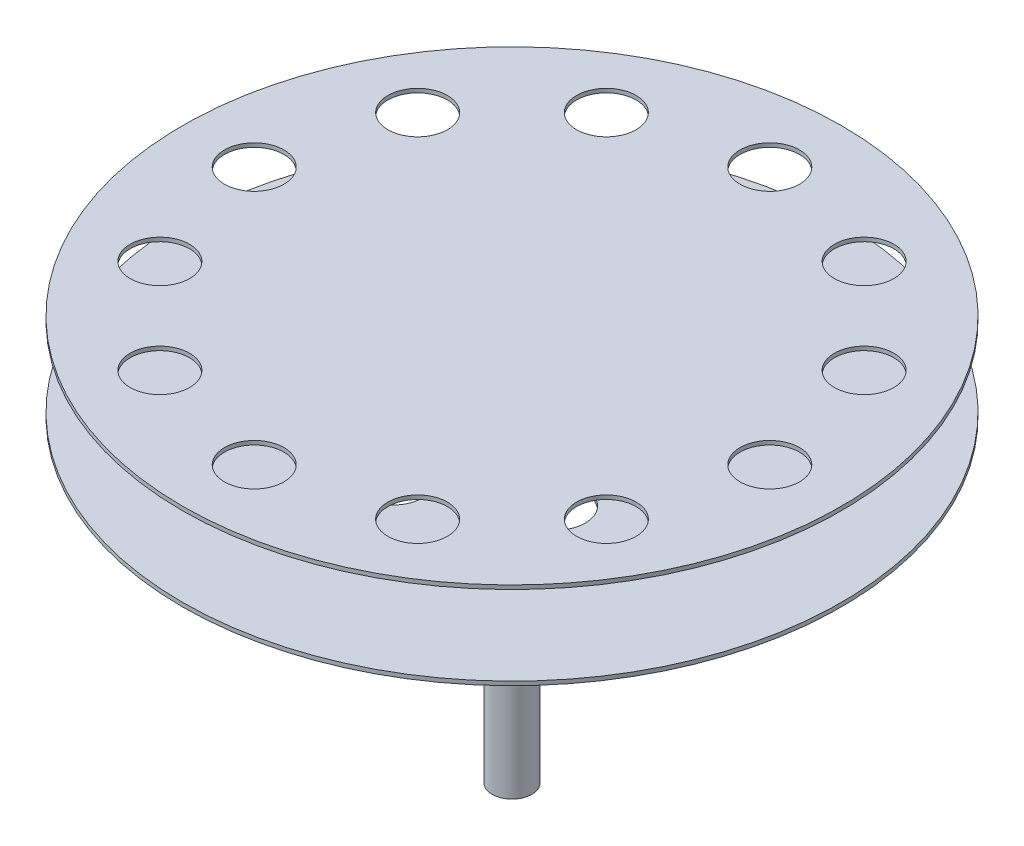
from build123d import *

# Parameters (mm, degrees)
SKETCH2_R          = 7.5
CUT_EXTRUDE1_DEPTH = 2
CIRPATTERN1_COUNT  = 12
SKETCH3_R          = 7.5
CUT_EXTRUDE2_DEPTH = 2
CIRPATTERN2_COUNT  = 6


with BuildPart() as part:
    # Sketch1 → Revolve1 (revolve)
    with BuildSketch(Plane.XY):
        Polygon((0, 102), (-83.09991, 102), (-83.09991, 101), (-5, 101), (-5, 81), (-83.09991, 81), (-83.09991, 80), (-5, 80), (-5, 0), (0, 0), align=None)
    revolve(axis=Axis((0, 54.874193188, 0), (0, -1, 0)))

    # Sketch2 → Cut-Extrude1 (cut)
    with BuildSketch(Plane(origin=(0, 102, 0), x_dir=(1, 0, 0), z_dir=(0, 1, 0))):
        with Locations((0, 65)):
            Circle(SKETCH2_R)
    cut_extrude1 = extrude(amount=-CUT_EXTRUDE1_DEPTH, mode=Mode.SUBTRACT)

    # CirPattern1: Cut-Extrude1 ×12 about axis
    cirpattern1_axis = Axis((0, 54.874193188, 0), (0, -1, 0))
    for i in range(1, CIRPATTERN1_COUNT):
        add(cut_extrude1.rotate(cirpattern1_axis, i * 360 / CIRPATTERN1_COUNT), mode=Mode.SUBTRACT)

    # Sketch3 → Cut-Extrude2 (cut)
    with BuildSketch(Plane.XZ.offset(-80)):
        with Locations((0, 30)):
            Circle(SKETCH3_R)
    cut_extrude2 = extrude(amount=-CUT_EXTRUDE2_DEPTH, mode=Mode.SUBTRACT)

    # CirPattern2: Cut-Extrude2 ×6 about axis
    cirpattern2_axis = Axis((0, 54.874193188, 0), (0, -1, 0))
    for i in range(1, CIRPATTERN2_COUNT):
        add(cut_extrude2.rotate(cirpattern2_axis, i * 360 / CIRPATTERN2_COUNT), mode=Mode.SUBTRACT)


solid = part.part
